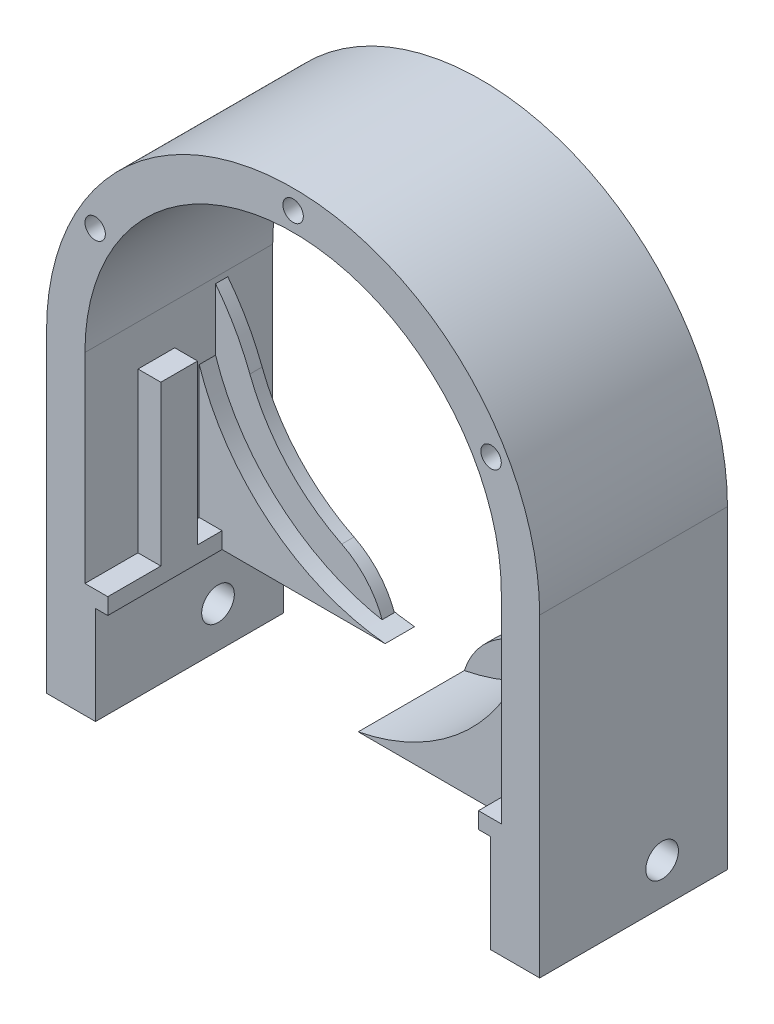
from build123d import *

# Parameters (mm, degrees)
BOSS_EXTRUDE1_DEPTH      = 8
BOSS_EXTRUDE2_DEPTH      = 6
BOSS_EXTRUDE2_DEPTH_BACK = 17
BOSS_EXTRUDE3_START      = 0.0001
BOSS_EXTRUDE3_DEPTH      = 0.0001
SKETCH6_W                = 6
SKETCH6_H                = 10
BOSS_EXTRUDE4_DEPTH      = 15
CUT_EXTRUDE6_START       = -10
CUT_EXTRUDE6_DEPTH       = 10
CUT_EXTRUDE1_REACH       = 90.809
SKETCH3_R                = 2
SKETCH9_W                = 2.8
SKETCH9_H                = 2
BOSS_EXTRUDE5_DEPTH      = 23
SKETCH10_W               = 3
SKETCH10_H               = 10
CUT_EXTRUDE7_DEPTH       = 15
SKETCH11_W               = 15
SKETCH11_H               = 10
CUT_EXTRUDE8_DEPTH       = 65
SKETCH15_W               = 2.8
SKETCH15_H               = 4.5
BOSS_EXTRUDE7_DEPTH      = 19.5
BOSS_EXTRUDE8_START      = -20
BOSS_EXTRUDE8_DEPTH      = 14.5
BOSS_EXTRUDE11_START     = -9
BOSS_EXTRUDE11_DEPTH     = 3.6
SKETCH19_R               = 1.25
CUT_EXTRUDE11_DEPTH      = 6
BOSS_EXTRUDE12_DEPTH     = 1.5
FILLET3_R                = 10
FILLET3_OF_MIRROR7_R     = 10


with BuildPart() as part:
    # Sketch1 → Boss-Extrude1 (new body)
    with BuildSketch(Plane.XY):
        with BuildLine():
            Line((22.5, 0), (22.5, 26.5))
            ThreePointArc((22.5, 26.5), (15.909902577, 42.409902577), (0, 49))
            Line((0, 49), (0, 52))
            ThreePointArc((0, 52), (18.03122292, 44.53122292), (25.5, 26.5))
            Line((25.5, 26.5), (25.5, 0))
            Line((25.5, 0), (22.5, 0))
        make_face()
    boss_extrude1 = extrude(amount=BOSS_EXTRUDE1_DEPTH)

    # Mirror1: Boss-Extrude1 across plane
    add(boss_extrude1.mirror(Plane(origin=(0, 52, 8), x_dir=(0, 0, 1), z_dir=(1, 0, 0))))

    # Sketch7 → Cut-Extrude6 (cut)
    with BuildSketch(Plane.XY.offset(8).offset(CUT_EXTRUDE6_START)):
        with BuildLine():
            Line((-22.5, 26.5), (-22.5, 18.310669729))
            Line((-22.5, 18.310669729), (-22.5, -2))
            Line((-22.5, -2), (-25.5, -2))
            Line((-25.5, -2), (-25.5, 18.310669729))
            Line((-25.5, 18.310669729), (-25.5, 26.5))
            ThreePointArc((-25.5, 26.5), (0, 52), (25.5, 26.5))
            Line((25.5, 26.5), (25.5, 0))
            Line((25.5, 0), (22.5, 0))
            Line((22.5, 0), (22.5, 26.5))
            ThreePointArc((22.5, 26.5), (0, 49), (-22.5, 26.5))
        make_face()
    extrude(amount=CUT_EXTRUDE6_DEPTH, mode=Mode.SUBTRACT)


with BuildPart() as body_2:
    # Sketch2 → Boss-Extrude2 (new, two sides: drawn at the far end of the back side and taken through both)
    with BuildSketch(Plane(origin=(0, 0, 0), x_dir=(-1, 0, 0), z_dir=(0, 0, -1)).offset(-BOSS_EXTRUDE2_DEPTH_BACK)):
        with BuildLine():
            Line((24.2, 0), (24.2, -12))
            Line((24.2, -12), (30.2, -12))
            Line((30.2, -12), (30.2, 26.5))
            ThreePointArc((30.2, 26.5), (21.354624792, 47.854624792), (0, 56.7))
            Line((0, 56.7), (0, 52))
            ThreePointArc((0, 52), (18.03122292, 44.53122292), (25.5, 26.5))
            Line((25.5, 26.5), (25.5, 0))
            Line((25.5, 0), (24.2, 0))
        make_face()
    extrude(amount=BOSS_EXTRUDE2_DEPTH + BOSS_EXTRUDE2_DEPTH_BACK)


with BuildPart() as body_3:
    # Mirror3: mirrored copy
    add(body_2.part.mirror(Plane(origin=(0, 56.7, 17), x_dir=(0, 0, 1), z_dir=(1, 0, 0))))


with BuildPart() as body_2_1:
    add(body_2.part)

    add(body_3.part)  # Boss-Extrude3 merges body 3
    # Sketch5 → Boss-Extrude3 (add)
    with BuildSketch(Plane(origin=(0, 0, -6), x_dir=(-1, 0, 0), z_dir=(0, 0, -1)).offset(BOSS_EXTRUDE3_START)):
        with BuildLine():
            Line((25.5, -12), (25.5, 26.5))
            ThreePointArc((25.5, 26.5), (0, 52), (-25.5, 26.5))
            Line((-25.5, 26.5), (-25.5, -12))
            Line((-25.5, -12), (-30.2, -12))
            Line((-30.2, -12), (-30.2, 26.5))
            ThreePointArc((-30.2, 26.5), (0, 56.7), (30.2, 26.5))
            Line((30.2, 26.5), (30.2, -12))
            Line((30.2, -12), (25.5, -12))
        make_face()
    extrude(amount=-BOSS_EXTRUDE3_DEPTH)

    # Sketch6 → Boss-Extrude4 (add)
    with BuildSketch(Plane.XY.offset(17)):
        with Locations((-27.2, -7)):
            Rectangle(SKETCH6_W, SKETCH6_H)
    boss_extrude4 = extrude(amount=BOSS_EXTRUDE4_DEPTH)

    # Mirror4: Boss-Extrude4 across plane
    add(boss_extrude4.mirror(Plane(origin=(0, 0, 0), x_dir=(0, 0, 1), z_dir=(1, 0, 0))))

    # Mirror5: Boss-Extrude4 across plane
    add(boss_extrude4.mirror(Plane(origin=(0, 0, 0), x_dir=(0, 0, 1), z_dir=(1, 0, 0))))

    # Sketch3 → Cut-Extrude1 (cut, up to next)
    with BuildSketch(Plane.ZY.offset(30.2), mode=Mode.PRIVATE) as cut_extrude1_sk1:
        with Locations((29.9999, -7)):
            Circle(SKETCH3_R)
    cut_extrude1_tool1 = extrude(cut_extrude1_sk1.sketch, amount=-CUT_EXTRUDE1_REACH, mode=Mode.PRIVATE) & body_2_1.part
    # Sketch3 → Cut-Extrude1 (cut, up to next)
    with BuildSketch(Plane.ZY.offset(30.2), mode=Mode.PRIVATE) as cut_extrude1_sk2:
        with Locations((1.9999, -7)):
            Circle(SKETCH3_R)
    cut_extrude1_tool2 = extrude(cut_extrude1_sk2.sketch, amount=-CUT_EXTRUDE1_REACH, mode=Mode.PRIVATE) & body_2_1.part
    add(cut_extrude1_tool1.solids().sort_by_distance((-30.2, -7, 29.9999))[0], mode=Mode.SUBTRACT)
    add(cut_extrude1_tool1.solids().sort_by_distance((-30.2, -7, 29.9999))[1], mode=Mode.SUBTRACT)
    add(cut_extrude1_tool2.solids().sort_by_distance((-30.2, -7, 1.9999))[0], mode=Mode.SUBTRACT)
    add(cut_extrude1_tool2.solids().sort_by_distance((-30.2, -7, 1.9999))[1], mode=Mode.SUBTRACT)

    # Sketch9 → Boss-Extrude5 (add)
    with BuildSketch(Plane(origin=(0, 0, -6), x_dir=(-1, 0, 0), z_dir=(0, 0, -1))):
        with Locations((24.1, 1)):
            Rectangle(SKETCH9_W, SKETCH9_H)
    boss_extrude5 = extrude(amount=-BOSS_EXTRUDE5_DEPTH)

    # Mirror6: Boss-Extrude5 across plane
    add(boss_extrude5.mirror(Plane(origin=(0, 0, 0), x_dir=(0, 0, 1), z_dir=(1, 0, 0))))

    # Sketch10 → Cut-Extrude7 (cut)
    with BuildSketch(Plane.XY.offset(32)):
        with Locations((25.7, -7)):
            Rectangle(SKETCH10_W, SKETCH10_H)
    extrude(amount=-CUT_EXTRUDE7_DEPTH, mode=Mode.SUBTRACT)

    # Sketch11 → Cut-Extrude8 (cut)
    with BuildSketch(Plane.ZY.offset(30.2)):
        with Locations((24.5, -7)):
            Rectangle(SKETCH11_W, SKETCH11_H)
    extrude(amount=-CUT_EXTRUDE8_DEPTH, mode=Mode.SUBTRACT)

    # Sketch15 → Boss-Extrude7 (add)
    with BuildSketch(Plane(origin=(0, 2, 0), x_dir=(1, 0, 0), z_dir=(0, 1, 0))):
        with Locations((-24.1, -8.25)):
            Rectangle(SKETCH15_W, SKETCH15_H)
    extrude(amount=BOSS_EXTRUDE7_DEPTH)

    # Sketch16 → Boss-Extrude8 (add)
    with BuildSketch(Plane(origin=(0, 0, -6.0001), x_dir=(-1, 0, 0), z_dir=(0, 0, -1)).offset(BOSS_EXTRUDE8_START)):
        with BuildLine():
            Line((-25.5, 0), (-4.972040216, 0))
            ThreePointArc((-4.972040216, 0), (-17.724548794, 6.308156337), (-25.5, 18.222923222))
            Line((-25.5, 18.222923222), (-25.5, 0))
        make_face()
    extrude(amount=BOSS_EXTRUDE8_DEPTH)

    # Sketch19 → Cut-Extrude11 (cut)
    with BuildSketch(Plane.XY.offset(17)):
        with Locations((0, 54.3)):
            Circle(SKETCH19_R)
        with Locations((24.248711306, 40.3)):
            Circle(SKETCH19_R)
        with Locations((-24.248711306, 40.3)):
            Circle(SKETCH19_R)
    extrude(amount=-CUT_EXTRUDE11_DEPTH, mode=Mode.SUBTRACT)

    # Sketch21 → Boss-Extrude12 (add)
    with BuildSketch(Plane(origin=(0, 0, -0.5001), x_dir=(-1, 0, 0), z_dir=(0, 0, -1))):
        with BuildLine():
            Line((-25.5, 25.795756465), (-25.5, 18.222923222))
            ThreePointArc((-25.5, 18.222923222), (-17.724548794, 6.308156337), (-4.972040216, 0))
            Line((-4.972040216, 0), (-4.972040216, 4.089065169))
            ThreePointArc((-4.972040216, 4.089065169), (-14.912780115, 9.162068255), (-21.295198222, 18.317307692))
            ThreePointArc((-21.295198222, 18.317307692), (-23.119512448, 22.212887939), (-25.5, 25.795756465))
        make_face()
    boss_extrude12 = extrude(amount=-BOSS_EXTRUDE12_DEPTH)

    # Fillet3
    # the kernel refuses this fillet: 10 mm, written as the material it takes off along each edge
    with BuildSketch(Plane(origin=(4.972040216, 4.089065169, -13.967602165), x_dir=(0.9413494118920093, 0.33743337821052655, 0), z_dir=(0, 0, 1))) as fillet3_piece_1:
        with BuildLine():
            CenterArc((6.558088011, -9.931191011), FILLET3_R, 96.725267466, 45.815614847)
            Line((-1.379787074, -3.849239092), (-1.538544575, -3.727600054))
            ThreePointArc((-1.538544575, -3.727600054), (-0.878163419, -1.85713287), (-0.188269882, 0.067486676))
            Line((-0.188269882, 0.067486676), (0.023421743, 0.19862382))
            ThreePointArc((0.023421743, 0.19862382), (2.693500433, 0.041739326), (5.363579123, 0.19862382))
            Line((5.363579123, 0.19862382), (5.387000866, 0))
        make_face()
    extrude(amount=28.435004329, mode=Mode.SUBTRACT)

    # Mirror7: Boss-Extrude12 across plane
    add(boss_extrude12.mirror(Plane(origin=(0, 0, 0), x_dir=(0, 0, 1), z_dir=(1, 0, 0))))

    # Fillet3 of Mirror7
    # the kernel refuses this fillet: 10 mm, written as the material it takes off along each edge
    with BuildSketch(Plane(origin=(-4.972040216, 4.089065169, -13.967602165), x_dir=(0, -1, 0), z_dir=(0, 0, 1))) as fillet3_of_mirror7_piece_1:
        with BuildLine():
            CenterArc((7.135803026, -9.524567624), FILLET3_OF_MIRROR7_R, 107.738539154, 45.815614847)
            Line((-1.817753901, -5.071050097), (-1.996825039, -4.981979746))
            ThreePointArc((-1.996825039, -4.981979746), (-0.94816824, -2.521440807), (-0.194877694, 0.044974263))
            Line((-0.194877694, 0.044974263), (0, 0.2))
            ThreePointArc((0, 0.2), (2.044532584, 0.2), (4.028130412, 0.190491352))
            Line((4.028130412, 0.190491352), (4.089065169, 0))
        make_face()
    extrude(amount=28.435004329, mode=Mode.SUBTRACT)


with BuildPart() as body_2_2:
    # Sketch18 → Boss-Extrude11 (new body)
    with BuildSketch(Plane(origin=(0, 0, -6.0001), x_dir=(-1, 0, 0), z_dir=(0, 0, -1)).offset(BOSS_EXTRUDE11_START)):
        with BuildLine():
            Line((25.5, 18.22), (25.5, 0))
            Line((25.5, 0), (2.729505874, 0))
            ThreePointArc((2.729505874, 0), (16.83167007, 5.714525488), (25.5, 18.22))
        make_face()
    extrude(amount=BOSS_EXTRUDE11_DEPTH)


solid = Compound([body_2_1.part, body_2_2.part])
